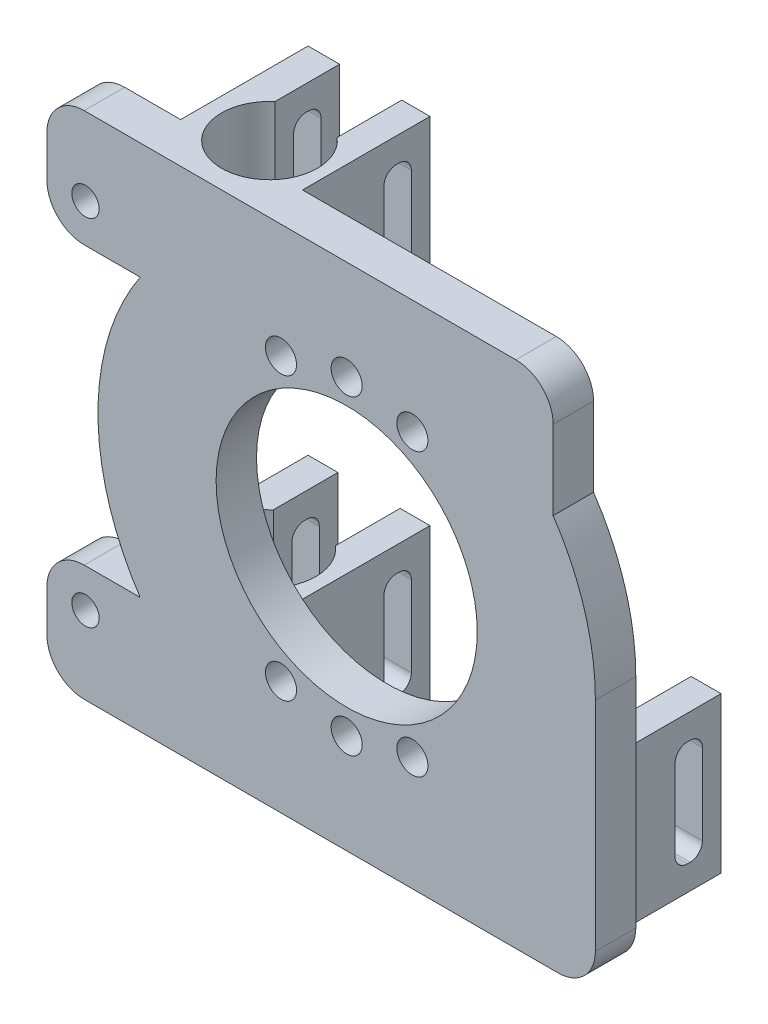
from build123d import *

# Parameters (mm, degrees)
SKETCH1_R                = 21
SKETCH1_R_2              = 2.5
SKETCH1_R_3              = 2.2
BASE_DEPTH               = 6.5
BELT_DIVETS_W            = 6
BELT_DIVETS_H            = 1
BELTDIVETS_DEPTH         = 0.8
SKETCH4_W                = 19.60560705
SKETCH4_H                = 25
BEARING1BREAKOUT_DEPTH   = 20.5
BEARIGN_SLOT_1_DEPTH     = 25
ZIPTIEHOLEBEARING1_DEPTH = 15.5
SKETCH9_W                = 19.60560705
SKETCH9_H                = 25
BEARIN2BREAKOUT_DEPTH    = 20.5
BEARING_SLOT_2_DEPTH     = 25
SKETCH13_W               = 19.61
SKETCH13_H               = 25
BEARING3BREAKOUT_DEPTH   = 20.5
BEARING_SLOT_3_DEPTH     = 25
ZIPTIEHOLEBEARING2_DEPTH = 100


with BuildPart() as part:
    # Sketch1 → Base (new body)
    with BuildSketch(Plane.XY):
        with BuildLine():
            Line((-33.207077559, 22.3), (-42.207077559, 22.3))
            ThreePointArc((-42.207077559, 22.3), (-46.449718246, 24.057359313), (-48.207077559, 28.3))
            Line((-48.207077559, 28.3), (-48.207077559, 30))
            Line((-48.207077559, 30), (-48.207077559, 35))
            ThreePointArc((-48.207077559, 35), (-46.449718246, 39.242640687), (-42.207077559, 41))
            Line((-42.207077559, 41), (0, 41))
            Line((0, 41), (27.207077559, 41))
            ThreePointArc((27.207077559, 41), (31.449718246, 39.242640687), (33.207077559, 35))
            Line((33.207077559, 35), (33.207077559, 22.3))
            ThreePointArc((33.207077559, 22.3), (38.264102644, 11.655833253), (40, 0))
            Line((40, 0), (40, -35))
            ThreePointArc((40, -35), (38.242640687, -39.242640687), (34, -41))
            Line((34, -41), (-42.207077559, -41))
            ThreePointArc((-42.207077559, -41), (-46.449718246, -39.242640687), (-48.207077559, -35))
            Line((-48.207077559, -35), (-48.207077559, -34.7))
            Line((-48.207077559, -34.7), (-48.207077559, -30))
            Line((-48.207077559, -30), (-48.207077559, -28.3))
            ThreePointArc((-48.207077559, -28.3), (-46.449718246, -24.057359313), (-42.207077559, -22.3))
            Line((-42.207077559, -22.3), (-33.207077559, -22.3))
            ThreePointArc((-33.207077559, -22.3), (-40, 0), (-33.207077559, 22.3))
        make_face()
        Circle(SKETCH1_R, mode=Mode.SUBTRACT)
        with Locations((0, 25)):
            Circle(SKETCH1_R_2, mode=Mode.SUBTRACT)
        with Locations((10.565456544, 22.657694676)):
            Circle(SKETCH1_R_2, mode=Mode.SUBTRACT)
        with Locations((-10.565456544, 22.657694676)):
            Circle(SKETCH1_R_2, mode=Mode.SUBTRACT)
        with Locations((-10.565456544, -22.657694676)):
            Circle(SKETCH1_R_2, mode=Mode.SUBTRACT)
        with Locations((0, -25)):
            Circle(SKETCH1_R_2, mode=Mode.SUBTRACT)
        with Locations((10.565456544, -22.657694676)):
            Circle(SKETCH1_R_2, mode=Mode.SUBTRACT)
        with Locations((-42.007077559, 28.5)):
            Circle(SKETCH1_R_3, mode=Mode.SUBTRACT)
        with Locations((-42.007077559, -28.5)):
            Circle(SKETCH1_R_3, mode=Mode.SUBTRACT)
    extrude(amount=BASE_DEPTH)

    # Belt_Divets → BeltDIvets (cut)
    with BuildSketch(Plane(origin=(0, 0, 0), x_dir=(-1, 0, 0), z_dir=(0, 0, -1))):
        with Locations((36.807077559, 39.5)):
            Rectangle(BELT_DIVETS_W, BELT_DIVETS_H)
        with Locations((36.807077559, 37.5)):
            Rectangle(BELT_DIVETS_W, BELT_DIVETS_H)
        with Locations((36.807077559, 35.5)):
            Rectangle(BELT_DIVETS_W, BELT_DIVETS_H)
        with Locations((36.807077559, 33.5)):
            Rectangle(BELT_DIVETS_W, BELT_DIVETS_H)
        with Locations((36.807077559, 31.5)):
            Rectangle(BELT_DIVETS_W, BELT_DIVETS_H)
        with Locations((36.807077559, 29.5)):
            Rectangle(BELT_DIVETS_W, BELT_DIVETS_H)
        with Locations((36.807077559, 27.5)):
            Rectangle(BELT_DIVETS_W, BELT_DIVETS_H)
        with Locations((36.807077559, 25.5)):
            Rectangle(BELT_DIVETS_W, BELT_DIVETS_H)
        with Locations((36.807077559, 23.5)):
            Rectangle(BELT_DIVETS_W, BELT_DIVETS_H)
    extrude(amount=-BELTDIVETS_DEPTH, mode=Mode.SUBTRACT)

    # Sketch4 → Bearing1Breakout (add)
    with BuildSketch(Plane(origin=(0, 0, 0), x_dir=(-1, 0, 0), z_dir=(0, 0, -1))):
        with Locations((23.404274034, 28.5)):
            Rectangle(SKETCH4_W, SKETCH4_H)
    extrude(amount=BEARING1BREAKOUT_DEPTH)

    # Sketch5 → Bearign_Slot_1 (cut)
    with BuildSketch(Plane(origin=(0, 41, 0), x_dir=(1, 0, 0), z_dir=(0, 1, 0))):
        with BuildLine():
            Line((-28.135734506, 20.5), (-18.135734506, 20.5))
            Line((-18.135734506, 20.5), (-18.135734506, 14.603885369))
            Line((-18.135734506, 14.603885369), (-18.135734506, 10.102040462))
            ThreePointArc((-18.135734506, 10.102040462), (-23.135734506, -3.5), (-28.135734506, 10.102040462))
            Line((-28.135734506, 10.102040462), (-28.135734506, 14.603885369))
            Line((-28.135734506, 14.603885369), (-28.135734506, 20.5))
        make_face()
    extrude(amount=-BEARIGN_SLOT_1_DEPTH, mode=Mode.SUBTRACT)

    # Sketch8 → ZipTieHoleBearing1 (cut, symmetric)
    with BuildSketch(Plane.ZY.offset(18.135734506)):
        with BuildLine():
            Line((-15.5, 20), (-15.102040462, 20))
            ThreePointArc((-15.102040462, 20), (-13.6878269, 20.585786438), (-13.102040462, 22))
            Line((-13.102040462, 22), (-13.102040462, 35))
            ThreePointArc((-13.102040462, 35), (-13.6878269, 36.414213562), (-15.102040462, 37))
            Line((-15.102040462, 37), (-15.5, 37))
            ThreePointArc((-15.5, 37), (-16.914213562, 36.414213562), (-17.5, 35))
            Line((-17.5, 35), (-17.5, 22))
            ThreePointArc((-17.5, 22), (-16.914213562, 20.585786438), (-15.5, 20))
        make_face()
    extrude(amount=ZIPTIEHOLEBEARING1_DEPTH, both=True, mode=Mode.SUBTRACT)

    # Sketch9 → Bearin2Breakout (add)
    with BuildSketch(Plane(origin=(0, 0, 0), x_dir=(-1, 0, 0), z_dir=(0, 0, -1))):
        with Locations((23.404274034, -28.5)):
            Rectangle(SKETCH9_W, SKETCH9_H)
    extrude(amount=BEARIN2BREAKOUT_DEPTH)

    # Sketch10 → Bearing_Slot_2 (cut)
    with BuildSketch(Plane.XZ.offset(41)):
        with BuildLine():
            Line((-28.404274034, -10.102040462), (-28.404274034, -20.5))
            Line((-28.404274034, -20.5), (-18.404274034, -20.5))
            Line((-18.404274034, -20.5), (-18.404274034, -10.102040462))
            ThreePointArc((-18.404274034, -10.102040462), (-23.404274034, 3.5), (-28.404274034, -10.102040462))
        make_face()
    extrude(amount=-BEARING_SLOT_2_DEPTH, mode=Mode.SUBTRACT)

    # Sketch13 → Bearing3Breakout (add)
    with BuildSketch(Plane(origin=(0, 0, 0), x_dir=(-1, 0, 0), z_dir=(0, 0, -1))):
        with Locations((-23.406470509, -28.5)):
            Rectangle(SKETCH13_W, SKETCH13_H)
    extrude(amount=BEARING3BREAKOUT_DEPTH)

    # Sketch14 → Bearing_Slot_3 (cut)
    with BuildSketch(Plane.XZ.offset(41)):
        with BuildLine():
            Line((28.406470509, -20.5), (28.406470509, -10.102040462))
            ThreePointArc((28.406470509, -10.102040462), (23.406470509, 3.5), (18.406470509, -10.102040462))
            Line((18.406470509, -10.102040462), (18.406470509, -20.5))
            Line((18.406470509, -20.5), (28.406470509, -20.5))
        make_face()
    extrude(amount=-BEARING_SLOT_3_DEPTH, mode=Mode.SUBTRACT)

    # Sketch12 → ZipTieHoleBearing2 (cut, symmetric)
    with BuildSketch(Plane(origin=(-28.404274034, 0, 0), x_dir=(0, 0, -1), z_dir=(1, 0, 0))):
        with BuildLine():
            Line((15.5, -20), (15.102040462, -20))
            ThreePointArc((15.102040462, -20), (13.6878269, -20.585786438), (13.102040462, -22))
            Line((13.102040462, -22), (13.102040462, -35))
            ThreePointArc((13.102040462, -35), (13.6878269, -36.414213562), (15.102040462, -37))
            Line((15.102040462, -37), (15.5, -37))
            ThreePointArc((15.5, -37), (16.914213562, -36.414213562), (17.5, -35))
            Line((17.5, -35), (17.5, -22))
            ThreePointArc((17.5, -22), (16.914213562, -20.585786438), (15.5, -20))
        make_face()
    extrude(amount=ZIPTIEHOLEBEARING2_DEPTH, both=True, mode=Mode.SUBTRACT)


solid = part.part
